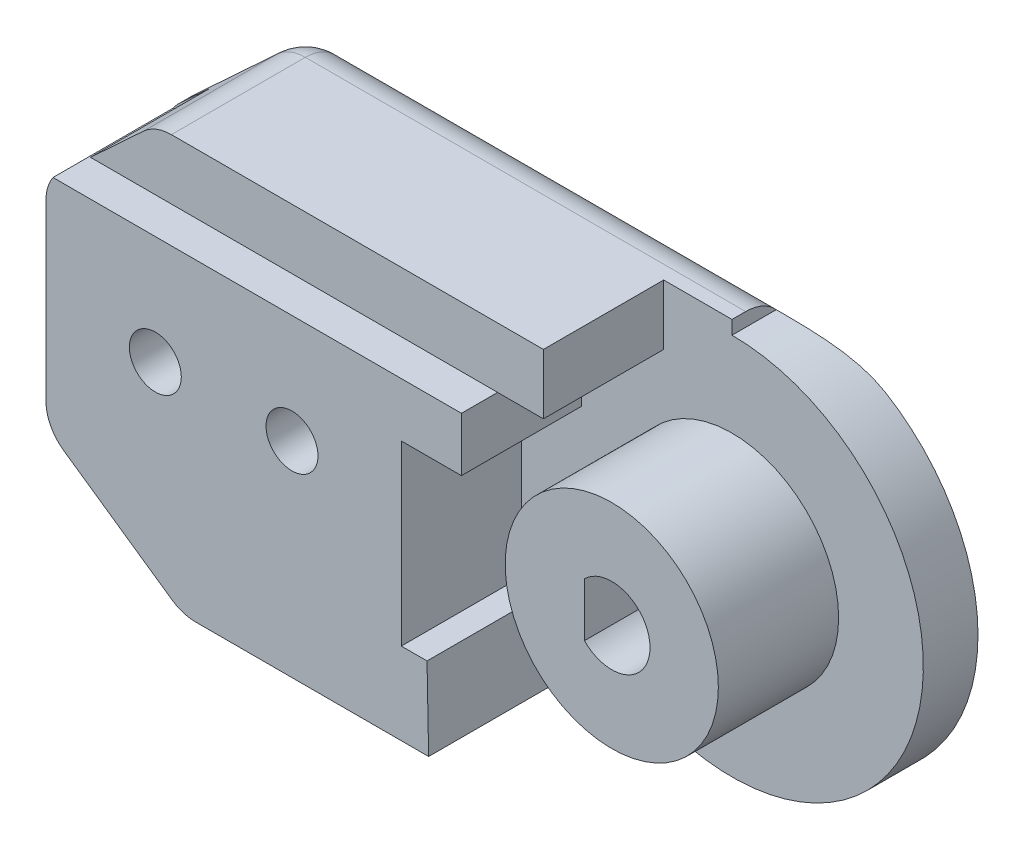
from build123d import *

# Parameters (mm, degrees)
BOSS_EXTRUDE1_DEPTH = 2
BOSS_EXTRUDE2_DEPTH = 8
SKETCH24_R          = 3.9
BOSS_EXTRUDE5_DEPTH = 4.4
SKETCH30_W          = 4.40861202
SKETCH30_H          = 1.324178481
CUT_EXTRUDE12_DEPTH = 16
CUT_EXTRUDE11_DEPTH = 23.928148639
FILLET1_R           = 1.5
SKETCH34_W          = 1.5
SKETCH34_H          = 1.5
CUT_EXTRUDE13_DEPTH = 8
SKETCH36_R          = 0.95
CUT_EXTRUDE15_DEPTH = 8
SKETCH37_R          = 2
CUT_EXTRUDE16_DEPTH = 4.5
SKETCH38_W          = 3
SKETCH38_H          = 1.25
CUT_EXTRUDE17_DEPTH = 3.6


with BuildPart() as part:
    # Sketch2 → Boss-Extrude1 (new body)
    with BuildSketch(Plane.XY):
        with BuildLine():
            Line((-2.5, 7.5), (-16.7, 7.5))
            Line((-16.7, 7.5), (-20.7, 3.793442666))
            Line((-20.7, 3.793442666), (-20.7, -4.031648778))
            Line((-20.7, -4.031648778), (-15.7, -7.5))
            Line((-15.7, -7.5), (-6.7, -7.5))
            Line((-6.7, -7.5), (-4.2, -5.6))
            ThreePointArc((-4.2, -5.6), (3.130495168, -6.260990337), (7, 0))
            ThreePointArc((7, 0), (4.949747468, 4.949747468), (0, 7))
            Line((0, 7), (0, 7.5))
            Line((0, 7.5), (-2.5, 7.5))
        make_face()
    extrude(amount=BOSS_EXTRUDE1_DEPTH)

    # Sketch4 → Boss-Extrude2 (add)
    with BuildSketch(Plane.XY.offset(2)):
        Polygon((-15.7, -7.5), (-6.7, -7.5), (-6.759079174, -4.5), (-7.7, -4.5), (-7.7, 2), (-5.5, 2), (-5.5, 5.3), (-2.5, 5.3), (-2.5, 7.5), (-16.7, 7.5), (-20.7, 3.793442666), (-20.7, -4.031648778), align=None)
    extrude(amount=BOSS_EXTRUDE2_DEPTH)

    # Sketch24 → Boss-Extrude5 (add)
    with BuildSketch(Plane.XY.offset(2)):
        Circle(SKETCH24_R)
    extrude(amount=BOSS_EXTRUDE5_DEPTH)

    # Sketch30 → Cut-Extrude12 (cut)
    with BuildSketch(Plane(origin=(-5.5, 0, 0), x_dir=(0, 0, -1), z_dir=(1, 0, 0))):
        with Locations((-4.20430601, 4.63791076)):
            Rectangle(SKETCH30_W, SKETCH30_H)
    extrude(amount=-CUT_EXTRUDE12_DEPTH, mode=Mode.SUBTRACT)

    # Sketch28 → Cut-Extrude11 (cut, through all)
    with BuildSketch(Plane.XY.offset(6.4)):
        with BuildLine():
            Line((-1, 0.979795897), (-1, -0.979795897))
            ThreePointArc((-1, -0.979795897), (1.4, 0), (-1, 0.979795897))
        make_face()
    extrude(amount=-CUT_EXTRUDE11_DEPTH, mode=Mode.SUBTRACT)

    # Fillet1
    # the kernel refuses this fillet: 1.5 mm, written as the material it takes off along each edge
    with BuildSketch(Plane(origin=(-15.230677435, -6, 1.5), x_dir=(-0.5699665637840448, -0.8216678867816415, 0), z_dir=(0, 0, -1))) as fillet1_piece_1_section:
        Polygon((0, 0), (FILLET1_R * 1.02, 0), (FILLET1_R * 1.02, -FILLET1_R * 0.319139344377), (FILLET1_R * 0.838101244517, -FILLET1_R * 0.58136589506), align=None)
    fillet1_piece_1 = extrude(amount=FILLET1_R * 1.02, mode=Mode.PRIVATE)
    fillet1_piece_1 = fillet1_piece_1 - Plane(origin=(-15.230677435, -6, 1.5), x_dir=(0.29860685961507855, 0.9543762064253388, 0), z_dir=(0, 0, -1)) * Sphere(FILLET1_R, mode=Mode.PRIVATE)
    add(fillet1_piece_1, mode=Mode.SUBTRACT)
    with BuildSketch(Plane(origin=(-16.11186344, 6, 1.5), x_dir=(-0.6796897201843015, 0.7334997506991983, 0), z_dir=(0, 0, -1))) as fillet1_piece_2_section:
        Polygon((0, 0), (FILLET1_R * 1.02, 0), (FILLET1_R * 1.02, FILLET1_R * 0.399932860855), (FILLET1_R * 0.748169745713, FILLET1_R * 0.693283514588), align=None)
    fillet1_piece_2 = extrude(amount=FILLET1_R * 1.02, mode=Mode.PRIVATE)
    fillet1_piece_2 = fillet1_piece_2 - Plane(origin=(-16.11186344, 6, 1.5), x_dir=(0.3650344157067945, -0.9309940254102596, 0), z_dir=(0, 0, -1)) * Sphere(FILLET1_R, mode=Mode.PRIVATE)
    add(fillet1_piece_2, mode=Mode.SUBTRACT)
    with BuildSketch(Plane(origin=(-19.2, 3.138411196, 1.5), x_dir=(-0.6796897201843015, 0.7334997506991983, 0), z_dir=(0, 0, -1))) as fillet1_piece_3_section:
        Polygon((0, 0), (FILLET1_R * 1.02, 0), (FILLET1_R * 1.02, -FILLET1_R * 0.445421399395), (FILLET1_R * 0.693283514588, -FILLET1_R * 0.748169745713), align=None)
    fillet1_piece_3 = extrude(amount=FILLET1_R * 1.02, mode=Mode.PRIVATE)
    fillet1_piece_3 = fillet1_piece_3 - Plane(origin=(-19.2, 3.138411196, 1.5), x_dir=(0.9164304993244992, -0.40019387789901173, 0), z_dir=(0, 0, -1)) * Sphere(FILLET1_R, mode=Mode.PRIVATE)
    add(fillet1_piece_3, mode=Mode.SUBTRACT)
    with BuildSketch(Plane(origin=(-19.2, -3.246599046, 1.5), x_dir=(-0.5699665637840448, -0.8216678867816415, 0), z_dir=(0, 0, -1))) as fillet1_piece_4_section:
        Polygon((0, 0), (FILLET1_R * 1.02, 0), (FILLET1_R * 1.02, FILLET1_R * 0.533833817771), (FILLET1_R * 0.58136589506, FILLET1_R * 0.838101244517), align=None)
    fillet1_piece_4 = extrude(amount=FILLET1_R * 1.02, mode=Mode.PRIVATE)
    fillet1_piece_4 = fillet1_piece_4 - Plane(origin=(-19.2, -3.246599046, 1.5), x_dir=(0.8859928227090906, 0.46369895202380795, 0), z_dir=(0, 0, -1)) * Sphere(FILLET1_R, mode=Mode.PRIVATE)
    add(fillet1_piece_4, mode=Mode.SUBTRACT)
    with BuildSketch(Plane(origin=(-15.230677435, -7.5, 0), x_dir=(0, 1, 0), z_dir=(1, 0, 0))) as fillet1_piece_5_section:
        with BuildLine():
            CenterArc((FILLET1_R, FILLET1_R), FILLET1_R, 180, 90)
            Line((0, FILLET1_R), (0, 0))
            Line((0, 0), (FILLET1_R, 0))
        make_face()
    fillet1_piece_5 = extrude(amount=12.280677435, mode=Mode.PRIVATE)
    fillet1_piece_5 = split(fillet1_piece_5, bisect_by=Plane(origin=(-9.092127217, -9.318016685, 0.3282266), z_dir=(-0.6050832675335577, 0.7961621941231027, 0)), keep=Keep.TOP, mode=Mode.PRIVATE)
    add(fillet1_piece_5, mode=Mode.SUBTRACT)
    with BuildSketch(Plane(origin=(3.75, 7.5, 0), x_dir=(0, 0, 1), z_dir=(-1, 0, 0))) as fillet1_piece_6:
        with BuildLine():
            CenterArc((FILLET1_R, -FILLET1_R), FILLET1_R, 90, 90)
            Line((0, -FILLET1_R), (0, 0))
            Line((0, 0), (FILLET1_R, 0))
        make_face()
    extrude(amount=19.86186344, mode=Mode.SUBTRACT)
    with BuildSketch(Plane(origin=(-17.13139802, 7.100249626, 0), x_dir=(0.6796897201843014, -0.7334997506991981, 0), z_dir=(-0.7334997506991983, -0.6796897201843015, 0))) as fillet1_piece_7:
        with BuildLine():
            CenterArc((FILLET1_R, FILLET1_R), FILLET1_R, 180, 90)
            Line((0, FILLET1_R), (0, 0))
            Line((0, 0), (FILLET1_R, 0))
        make_face()
    extrude(amount=4.21013989, mode=Mode.SUBTRACT)
    with BuildSketch(Plane(origin=(-20.054949846, -4.479100876, 0), x_dir=(0.5699665637840448, 0.8216678867816416, 0), z_dir=(0.8216678867816415, -0.5699665637840448, 0))) as fillet1_piece_8:
        with BuildLine():
            CenterArc((FILLET1_R, FILLET1_R), FILLET1_R, 180, 90)
            Line((0, FILLET1_R), (0, 0))
            Line((0, 0), (FILLET1_R, 0))
        make_face()
    extrude(amount=4.830811364, mode=Mode.SUBTRACT)
    with BuildSketch(Plane(origin=(-20.7, 3.138411196, 0), x_dir=(1, 0, 0), z_dir=(0, -1, 0))) as fillet1_piece_9:
        with BuildLine():
            CenterArc((FILLET1_R, FILLET1_R), FILLET1_R, 180, 90)
            Line((0, FILLET1_R), (0, 0))
            Line((0, 0), (FILLET1_R, 0))
        make_face()
    extrude(amount=6.385010242, mode=Mode.SUBTRACT)
    with BuildSketch(Plane(origin=(-15.7, -7.5, 1.5), x_dir=(1, 0, 0), z_dir=(0, 0, 1))) as fillet1_piece_10:
        with BuildLine():
            CenterArc((FILLET1_R * 0.312881710173, FILLET1_R), FILLET1_R, 235.252105822, 34.747894178)
            Line((-FILLET1_R * 0.257084853611, FILLET1_R * 0.178332113218), (0, 0))
            Line((0, 0), (FILLET1_R * 0.312881710173, 0))
        make_face()
    extrude(amount=9.673306413, mode=Mode.SUBTRACT)
    with BuildSketch(Plane(origin=(-20.7, -4.031648778, 1.5), x_dir=(0, 1, 0), z_dir=(0, 0, 1))) as fillet1_piece_11:
        with BuildLine():
            CenterArc((FILLET1_R * 0.523366488011, -FILLET1_R), FILLET1_R, 90, 55.252105822)
            Line((-FILLET1_R * 0.298301398771, -FILLET1_R * 0.430033436216), (0, 0))
            Line((0, 0), (FILLET1_R * 0.523366488011, 0))
        make_face()
    extrude(amount=10.46262433, mode=Mode.SUBTRACT)
    with BuildSketch(Plane(origin=(-20.7, 3.793442666, 1.5), x_dir=(0.7334997506991984, 0.6796897201843014, 0), z_dir=(0, 0, 1))) as fillet1_piece_12:
        with BuildLine():
            CenterArc((FILLET1_R * 0.436687646465, -FILLET1_R), FILLET1_R, 90, 47.18059856)
            Line((-FILLET1_R * 0.296812104234, -FILLET1_R * 0.320310279816), (0, 0))
            Line((0, 0), (FILLET1_R * 0.436687646465, 0))
        make_face()
    extrude(amount=10.137578674, mode=Mode.SUBTRACT)
    with BuildSketch(Plane(origin=(-16.7, 7.5, 1.5), x_dir=(1, 0, 0), z_dir=(0, 0, 1))) as fillet1_piece_13:
        with BuildLine():
            CenterArc((FILLET1_R * 0.392091040054, -FILLET1_R), FILLET1_R, 90, 42.81940144)
            Line((-FILLET1_R * 0.287598680131, -FILLET1_R * 0.266500249301), (0, 0))
            Line((0, 0), (FILLET1_R * 0.392091040054, 0))
        make_face()
    extrude(amount=9.9703414, mode=Mode.SUBTRACT)

    # Sketch34 → Cut-Extrude13 (cut, along a direction that is not the sketch's normal)
    with BuildSketch(Plane.XZ.offset(-2)):
        with Locations((-6.95, 10)):
            Rectangle(SKETCH34_W, SKETCH34_H)
    extrude(amount=-CUT_EXTRUDE13_DEPTH, dir=(0.6685833876565112, -0.7436371788377336, 0), mode=Mode.SUBTRACT)

    # Sketch36 → Cut-Extrude15 (cut)
    with BuildSketch(Plane.XY.offset(10)):
        with Locations((-11.7, 0)):
            Circle(SKETCH36_R)
        with Locations((-16.7, 0)):
            Circle(SKETCH36_R)
    extrude(amount=-CUT_EXTRUDE15_DEPTH, mode=Mode.SUBTRACT)

    # Sketch37 → Cut-Extrude16 (cut)
    with BuildSketch(Plane(origin=(0, 0, 0), x_dir=(-1, 0, 0), z_dir=(0, 0, -1))):
        with Locations((11.7, 0)):
            Circle(SKETCH37_R)
        with Locations((16.7, 0)):
            Circle(SKETCH37_R)
    extrude(amount=-CUT_EXTRUDE16_DEPTH, mode=Mode.SUBTRACT)

    # Sketch38 → Cut-Extrude17 (cut)
    with BuildSketch(Plane.XY.offset(10)):
        with Locations((-4, 5.925)):
            Rectangle(SKETCH38_W, SKETCH38_H)
    extrude(amount=-CUT_EXTRUDE17_DEPTH, mode=Mode.SUBTRACT)


with BuildPart() as body_2:
    # Split1: the piece on the far side of the plane
    add(part.part)
    split(bisect_by=Plane.XY.offset(6.4), keep=Keep.BOTTOM)


with BuildPart() as part_1:
    add(part.part)

    # Split1
    split(bisect_by=Plane.XY.offset(6.4), keep=Keep.TOP)


solid = body_2.part
